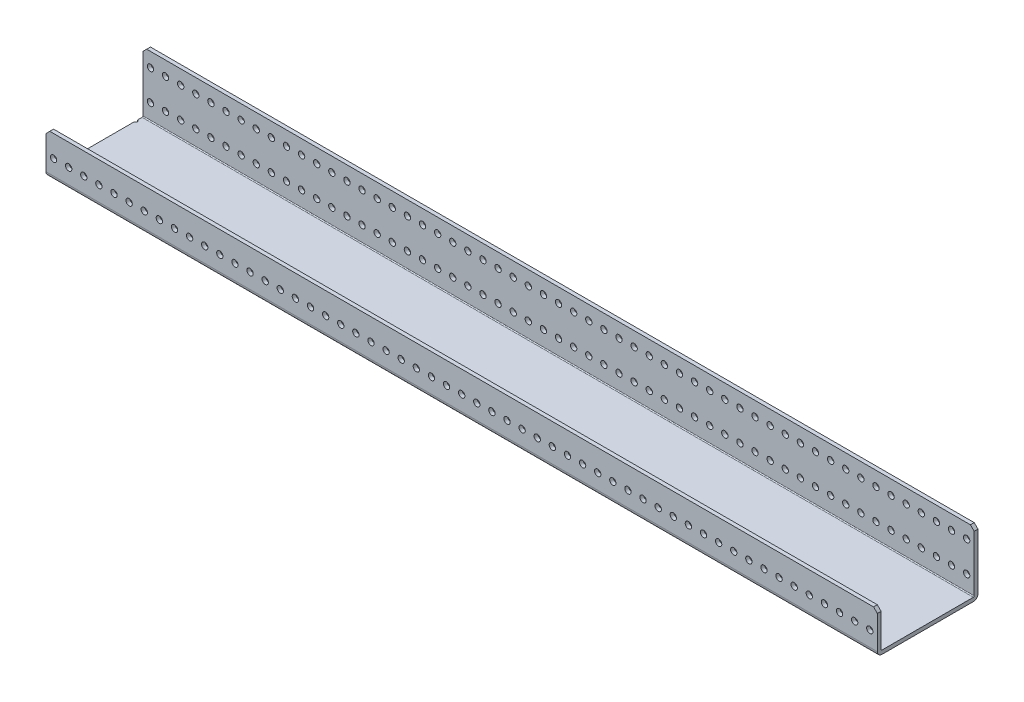
from build123d import *

# Parameters (mm, degrees)
SKETCH1_W            = 698.5
SKETCH1_H            = 84.582
BOSS_EXTRUDE1_DEPTH  = 34.925
SKETCH2_W            = 81.407
SKETCH2_H            = 31.75
CUT_EXTRUDE1_DEPTH   = 716.844146858
SKETCH3_W            = 698.5
SKETCH3_H            = 3.175
BOSS_EXTRUDE2_DEPTH  = 50.8
M2_CLEARANCE_HOLE1_D = 2.54
M5_CLEARANCE_HOLE1_D = 5.334
CHAMFER1_SIZE        = 3.175
FILLET1_R            = 0.762
FILLET2_R            = 3.937


with BuildPart() as part:
    # Sketch1 → Boss-Extrude1 (new body)
    with BuildSketch(Plane(origin=(0, 57.816398039, 0), x_dir=(1, 0, 0), z_dir=(0, 1, 0))):
        with Locations((253.148031467, -103.269491579)):
            Rectangle(SKETCH1_W, SKETCH1_H)
    extrude(amount=-BOSS_EXTRUDE1_DEPTH)

    # Sketch2 → Cut-Extrude1 (cut, through all)
    with BuildSketch(Plane(origin=(602.398031467, 0, 0), x_dir=(0, 0, -1), z_dir=(1, 0, 0))):
        with Locations((-101.681991579, 41.941398039)):
            Rectangle(SKETCH2_W, SKETCH2_H)
    extrude(amount=-CUT_EXTRUDE1_DEPTH, mode=Mode.SUBTRACT)

    # Sketch3 → Boss-Extrude2 (add)
    with BuildSketch(Plane(origin=(0, 26.066398039, 0), x_dir=(-1, 0, 0), z_dir=(0, 1, 0))):
        with Locations((-253.148031467, 62.565991579)):
            Rectangle(SKETCH3_W, SKETCH3_H)
    extrude(amount=BOSS_EXTRUDE2_DEPTH)

    # M2 Clearance Hole1 (through all)
    with Locations(Plane(origin=(0, 26.066398039, 0), x_dir=(1, 0, 0), z_dir=(0, 1, 0))):
        with Locations((-96.101968533, -136.543491579), (-96.101968533, -69.995491579)):
            Hole(M2_CLEARANCE_HOLE1_D / 2)

    # M5 Clearance Hole1 (through all)
    with Locations(Plane(origin=(0, 0, 60.978491579), x_dir=(-1, 0, 0), z_dir=(0, 0, -1))):
        with Locations((-469.048031467, 64.928398039), (-481.748031467, 64.928398039), (-469.048031467, 39.528398039), (-481.748031467, 39.528398039), (-456.348031467, 39.528398039), (-443.648031467, 39.528398039), (-430.948031467, 39.528398039), (-418.248031467, 39.528398039), (-405.548031467, 39.528398039), (-392.848031467, 39.528398039), (-380.148031467, 39.528398039), (-367.448031467, 39.528398039), (-354.748031467, 39.528398039), (-342.048031467, 39.528398039), (-329.348031467, 39.528398039), (-316.648031467, 39.528398039), (-303.948031467, 39.528398039), (-291.248031467, 39.528398039), (-278.548031467, 39.528398039), (-265.848031467, 39.528398039), (-253.148031467, 39.528398039), (-240.448031467, 39.528398039), (-227.748031467, 39.528398039), (-215.048031467, 39.528398039), (-202.348031467, 39.528398039), (-189.648031467, 39.528398039), (-176.948031467, 39.528398039), (-164.248031467, 39.528398039), (-151.548031467, 39.528398039), (-138.848031467, 39.528398039), (-126.148031467, 39.528398039), (-113.448031467, 39.528398039), (-100.748031467, 39.528398039), (-88.048031467, 39.528398039), (-75.348031467, 39.528398039), (-62.648031467, 39.528398039), (-49.948031467, 39.528398039), (-37.248031467, 39.528398039), (-24.548031467, 39.528398039), (-11.848031467, 39.528398039), (0.851968533, 39.528398039), (13.551968533, 39.528398039), (26.251968533, 39.528398039), (38.951968533, 39.528398039), (51.651968533, 39.528398039), (64.351968533, 39.528398039), (77.051968533, 39.528398039), (89.751968533, 39.528398039), (-456.348031467, 64.928398039), (-443.648031467, 64.928398039), (-430.948031467, 64.928398039), (-418.248031467, 64.928398039), (-405.548031467, 64.928398039), (-392.848031467, 64.928398039), (-380.148031467, 64.928398039), (-367.448031467, 64.928398039), (-354.748031467, 64.928398039), (-342.048031467, 64.928398039), (-329.348031467, 64.928398039), (-316.648031467, 64.928398039), (-303.948031467, 64.928398039), (-291.248031467, 64.928398039), (-278.548031467, 64.928398039), (-265.848031467, 64.928398039), (-253.148031467, 64.928398039), (-240.448031467, 64.928398039), (-227.748031467, 64.928398039), (-215.048031467, 64.928398039), (-202.348031467, 64.928398039), (-189.648031467, 64.928398039), (-176.948031467, 64.928398039), (-164.248031467, 64.928398039), (-151.548031467, 64.928398039), (-138.848031467, 64.928398039), (-126.148031467, 64.928398039), (-113.448031467, 64.928398039), (-100.748031467, 64.928398039), (-88.048031467, 64.928398039), (-75.348031467, 64.928398039), (-62.648031467, 64.928398039), (-49.948031467, 64.928398039), (-37.248031467, 64.928398039), (-24.548031467, 64.928398039), (-11.848031467, 64.928398039), (0.851968533, 64.928398039), (13.551968533, 64.928398039), (26.251968533, 64.928398039), (38.951968533, 64.928398039), (51.651968533, 64.928398039), (64.351968533, 64.928398039), (77.051968533, 64.928398039), (89.751968533, 64.928398039), (-494.448031467, 64.928398039), (-494.448031467, 39.528398039), (-507.148031467, 64.928398039), (-507.148031467, 39.528398039), (-519.848031467, 64.928398039), (-519.848031467, 39.528398039), (-532.548031467, 64.928398039), (-532.548031467, 39.528398039), (-545.248031467, 64.928398039), (-545.248031467, 39.528398039), (-557.948031467, 64.928398039), (-557.948031467, 39.528398039), (-570.648031467, 64.928398039), (-570.648031467, 39.528398039), (-583.348031467, 64.928398039), (-583.348031467, 39.528398039), (-596.048031467, 64.928398039), (-596.048031467, 39.528398039)):
            Hole(M5_CLEARANCE_HOLE1_D / 2)

    # Chamfer1
    chamfer1_edges = [part.edges().sort_by_distance(p)[0] for p in [
        (602.398031467, 76.866398039, 62.565991579),
        (-96.101968533, 57.816398039, 143.972991579),
        (602.398031467, 57.816398039, 143.972991579),
        (-96.101968533, 76.866398039, 62.565991579),
    ]]
    chamfer(chamfer1_edges, length=CHAMFER1_SIZE)

    # Fillet1
    fillet1_edges = [part.edges().sort_by_distance(p)[0] for p in [
        (253.148031467, 26.066398039, 64.153491579),
        (253.148031467, 26.066398039, 142.385491579),
    ]]
    fillet(fillet1_edges, radius=FILLET1_R)

    # Fillet2
    fillet2_edges = [part.edges().sort_by_distance(p)[0] for p in [
        (253.148031467, 22.891398039, 145.560491579),
        (253.148031467, 22.891398039, 60.978491579),
    ]]
    fillet(fillet2_edges, radius=FILLET2_R)


solid = part.part
